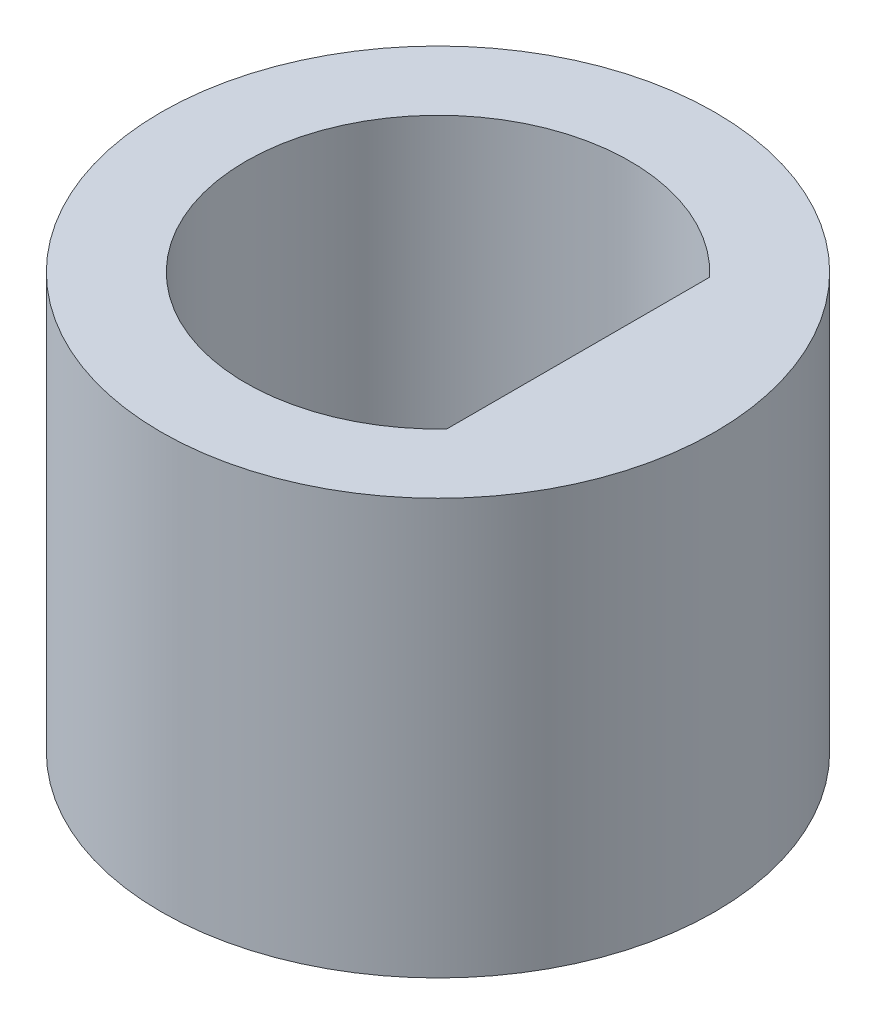
from build123d import *

# Parameters (mm, degrees)
SKETCH1_R           = 8
BOSS_EXTRUDE1_DEPTH = 12


with BuildPart() as part:
    # Sketch1 → Boss-Extrude1 (new body)
    with BuildSketch(Plane(origin=(0, 0, 0), x_dir=(1, 0, 0), z_dir=(0, 1, 0))):
        Circle(SKETCH1_R)
        with BuildLine():
            Line((4.05, 0), (4.05, 3.794733192))
            ThreePointArc((4.05, 3.794733192), (-5.55, 0), (4.05, -3.794733192))
            Line((4.05, -3.794733192), (4.05, 0))
        make_face(mode=Mode.SUBTRACT)
    extrude(amount=BOSS_EXTRUDE1_DEPTH)


solid = part.part
